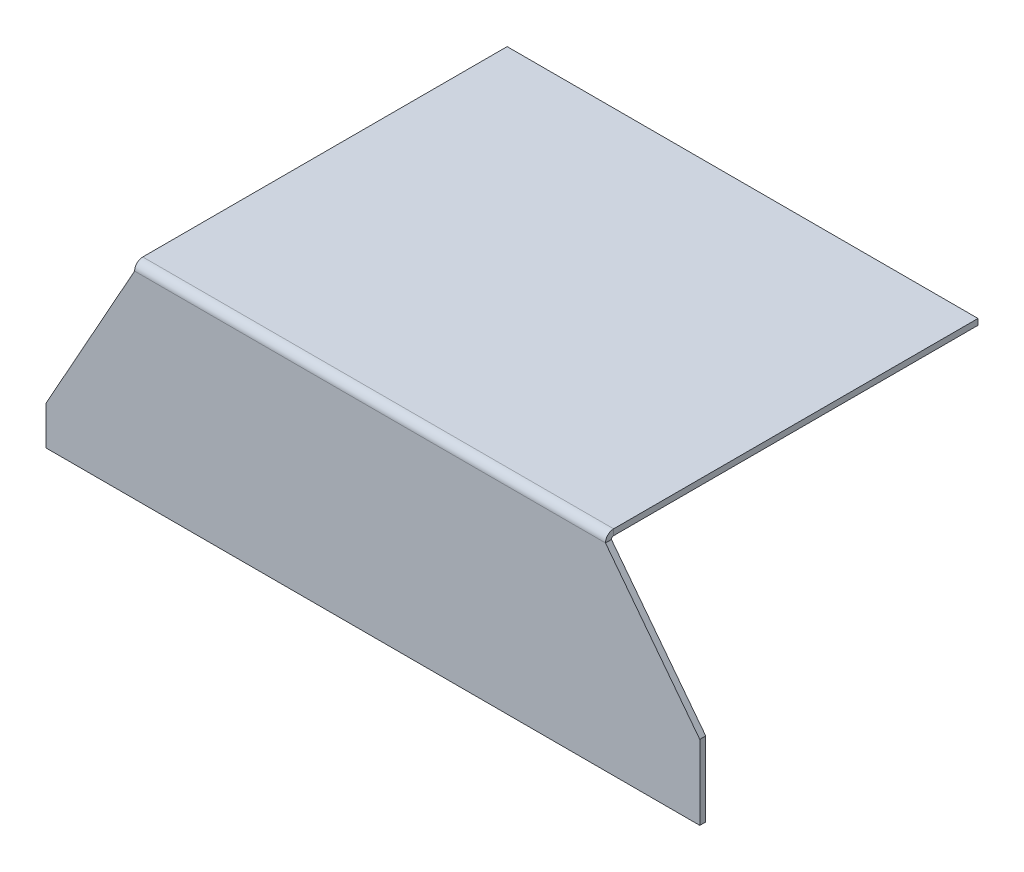
from build123d import *

# Parameters (mm, degrees)
SKETCH_1_W                       = 158
SKETCH_1_H                       = 125
SM_BASE_FLANGE_1_DEPTH           = 2
SM_EDGE_FLANGE_1_STRIP_W         = 9.4732
SM_EDGE_FLANGE_1_STRIP_H         = 2
SM_EDGE_FLANGE_1_STRIP_CUT_DEPTH = 158
SM_EDGE_FLANGE_1_DEPTH           = 158
SM_BASE_FLANGE_1_2_DEPTH         = 2


# Sheet-metal steps are written as plain solids
with BuildPart() as part:
    # Sketch 1 → Sm Base Flange 1 (new body)
    with BuildSketch(Plane(origin=(0, 0, 0), x_dir=(1, 0, 0), z_dir=(0, 1, 0))):
        Rectangle(SKETCH_1_W, SKETCH_1_H)
    extrude(amount=-SM_BASE_FLANGE_1_DEPTH)

    # 边线-法兰1 strip (across the edge) → 边线-法兰1 strip cut (cut)
    with BuildSketch(Plane(origin=(79, -2, 62.5), x_dir=(0, 0, -1), z_dir=(-1, 0, 0))):
        with Locations((-2, -1)):
            Rectangle(SM_EDGE_FLANGE_1_STRIP_W, SM_EDGE_FLANGE_1_STRIP_H)
    extrude(amount=SM_EDGE_FLANGE_1_STRIP_CUT_DEPTH, mode=Mode.SUBTRACT)

    # 边线-法兰1 section (across the edge) → 边线-法兰1 (add)
    with BuildSketch(Plane(origin=(79, -2, 62.5), x_dir=(0, 0, -1), z_dir=(-1, 0, 0))):
        with BuildLine():
            Line((0, 0.7366), (0, 67))
            Line((0, 67), (2, 67))
            Line((2, 67), (2, 0.7366))
            ThreePointArc((2, 0.7366), (2.215745145, 0.215745145), (2.7366, 0))
            Line((2.7366, 0), (2.7366, -2))
            ThreePointArc((2.7366, -2), (0.801531583, -1.198468417), (0, 0.7366))
        make_face()
    extrude(amount=SM_EDGE_FLANGE_1_DEPTH)

    # 草图9 → Sm Base Flange 1 2 (add)
    with BuildSketch(Plane.XY.offset(62.5)):
        Polygon((-79, -2.7366), (-108.732309369, -56), (-108.732309369, -69), (110.643827525, -69), (110.643827525, -44), (79, -2.7366), align=None)
    extrude(amount=-SM_BASE_FLANGE_1_2_DEPTH)


solid = part.part
